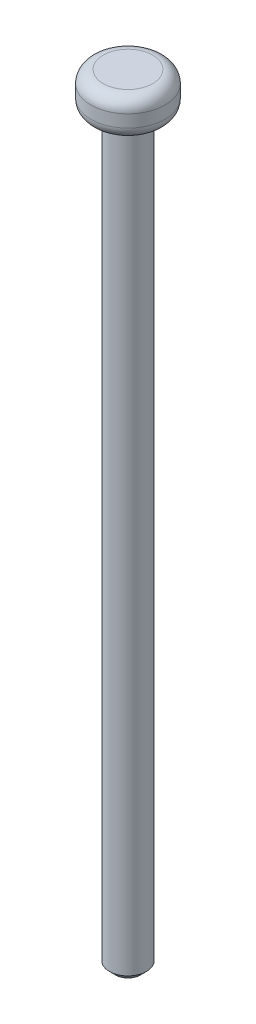
from build123d import *

# Parameters (mm, degrees)
FILLET1_R     = 0.1
CHAMFER1_SIZE = 0.05


with BuildPart() as part:
    # Sketch2 → Revolve1 (revolve)
    with BuildSketch(Plane.XY):
        Polygon((0, 0), (0.15, 0), (0.15, 6), (0.3, 6), (0.3, 6.3), (0, 6.3), align=None)
    revolve(axis=Axis((0, 6.3, 0), (0, -1, 0)))

    # Fillet1
    fillet1_edges = [part.edges().sort_by_distance(p)[0] for p in [
        (-0.3, 6, 0),
        (-0.3, 6.3, 0),
    ]]
    fillet(fillet1_edges, radius=FILLET1_R)

    # Chamfer1
    chamfer1_edges = [part.edges().sort_by_distance(p)[0] for p in [
        (-0.15, 0, 0),
    ]]
    chamfer(chamfer1_edges, length=CHAMFER1_SIZE)


solid = part.part
